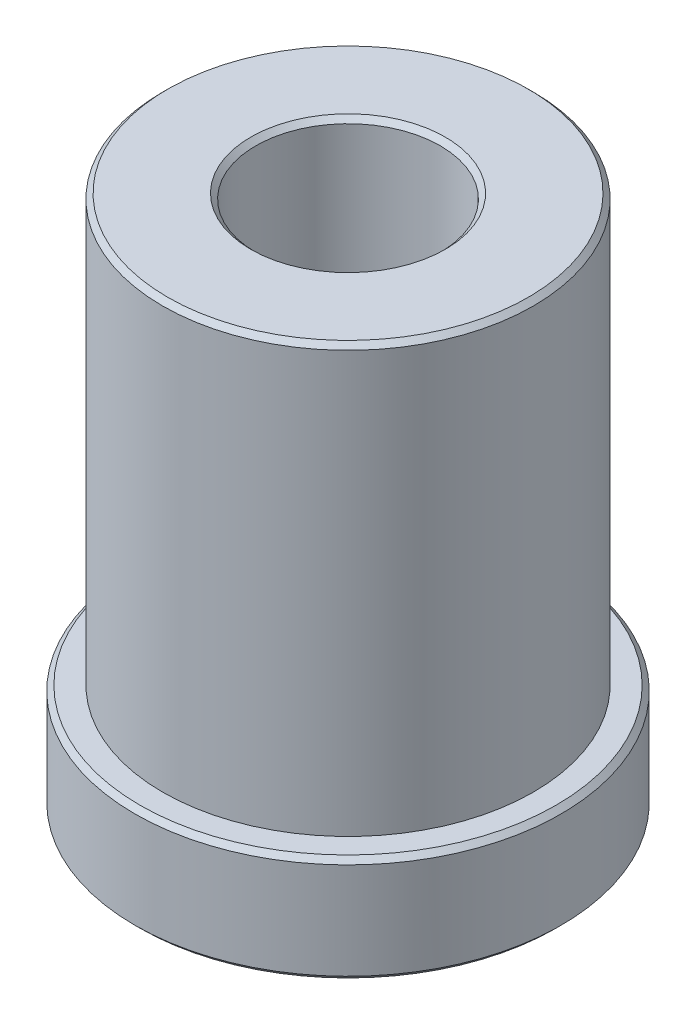
from build123d import *

# Parameters (mm, degrees)
SKETCH1_R           = 11.049
BOSS_EXTRUDE1_DEPTH = 25.4
SKETCH2_R           = 12.7
BOSS_EXTRUDE2_DEPTH = 6.35
SKETCH3_R           = 5.5
CUT_EXTRUDE1_DEPTH  = 37.477972806
CHAMFER1_SIZE       = 0.299999908


with BuildPart() as part:
    # Sketch1 → Boss-Extrude1 (new body)
    with BuildSketch(Plane(origin=(0, 0, 0), x_dir=(1, 0, 0), z_dir=(0, 1, 0))):
        Circle(SKETCH1_R)
    extrude(amount=BOSS_EXTRUDE1_DEPTH)

    # Sketch2 → Boss-Extrude2 (add)
    with BuildSketch(Plane.XZ):
        Circle(SKETCH2_R)
    extrude(amount=BOSS_EXTRUDE2_DEPTH)

    # Sketch3 → Cut-Extrude1 (cut, through all)
    with BuildSketch(Plane.XZ.offset(6.35)):
        Circle(SKETCH3_R)
    extrude(amount=-CUT_EXTRUDE1_DEPTH, mode=Mode.SUBTRACT)

    # Chamfer1
    chamfer1_edges = [part.edges().sort_by_distance(p)[0] for p in [
        (-12.7, 0, 0),
        (-12.7, -6.35, 0),
        (-11.049, 25.4, 0),
        (-5.5, 25.4, 0),
        (-5.5, -6.35, 0),
    ]]
    chamfer(chamfer1_edges, length=CHAMFER1_SIZE)


solid = part.part
